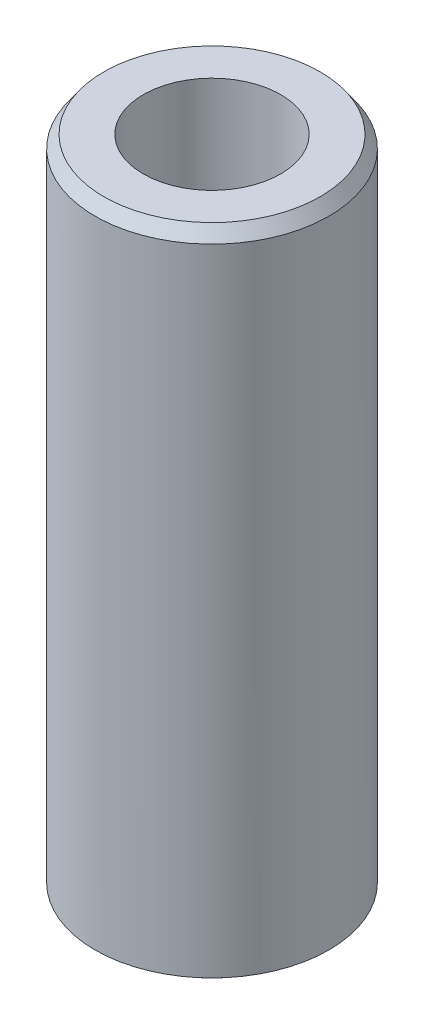
from build123d import *
from OCP.BRepFilletAPI import BRepFilletAPI_MakeChamfer

# Parameters (mm, degrees)
SKETCH1_R           = 17.5
BOSS_EXTRUDE1_DEPTH = 98.253043161
SKETCH2_R           = 10.283465767
CUT_EXTRUDE1_DEPTH  = 102.322063197
CHAMFER1_SIZE       = 1.863937448
CHAMFER1_SIZE2      = 1.314015417


with BuildPart() as part:
    # Sketch1 → Boss-Extrude1 (new body)
    with BuildSketch(Plane(origin=(0, 0, 0), x_dir=(1, 0, 0), z_dir=(0, 1, 0))):
        Circle(SKETCH1_R)
    extrude(amount=BOSS_EXTRUDE1_DEPTH)

    # Sketch2 → Cut-Extrude1 (cut, through all)
    with BuildSketch(Plane(origin=(0, 0, 0), x_dir=(1, 0, 0), z_dir=(0, 1, 0))):
        Circle(SKETCH2_R)
    extrude(amount=CUT_EXTRUDE1_DEPTH, mode=Mode.SUBTRACT)

    # Chamfer1: one chamfer whose edges measure the first distance from different faces: ONE call of the kernel's chamfer builder (chamfer() names one face for all edges)
    chamfer1_edges_1 = [part.edges().sort_by_distance(p)[0] for p in [
        (-17.5, 98.253043161, 0),
    ]]
    chamfer1_side_1 = [part.faces().sort_by_distance(p)[0] for p in [
        (-17.5, 49.126521581, 0),
    ]]
    chamfer1_edges_2 = [part.edges().sort_by_distance(p)[0] for p in [
        (-17.5, 0, 0),
    ]]
    chamfer1_side_2 = [part.faces().sort_by_distance(p)[0] for p in [
        (-17.005025253, 0, 0),
    ]]
    chamfer1 = BRepFilletAPI_MakeChamfer(part.part.solid().wrapped)
    for e in chamfer1_edges_1:
        chamfer1.Add(CHAMFER1_SIZE, CHAMFER1_SIZE2, e.wrapped, chamfer1_side_1[0].wrapped)  # the first distance lies on this face
    for e in chamfer1_edges_2:
        chamfer1.Add(CHAMFER1_SIZE, CHAMFER1_SIZE2, e.wrapped, chamfer1_side_2[0].wrapped)  # the first distance lies on this face
    add(Compound.cast(chamfer1.Shape()), mode=Mode.REPLACE)


solid = part.part
